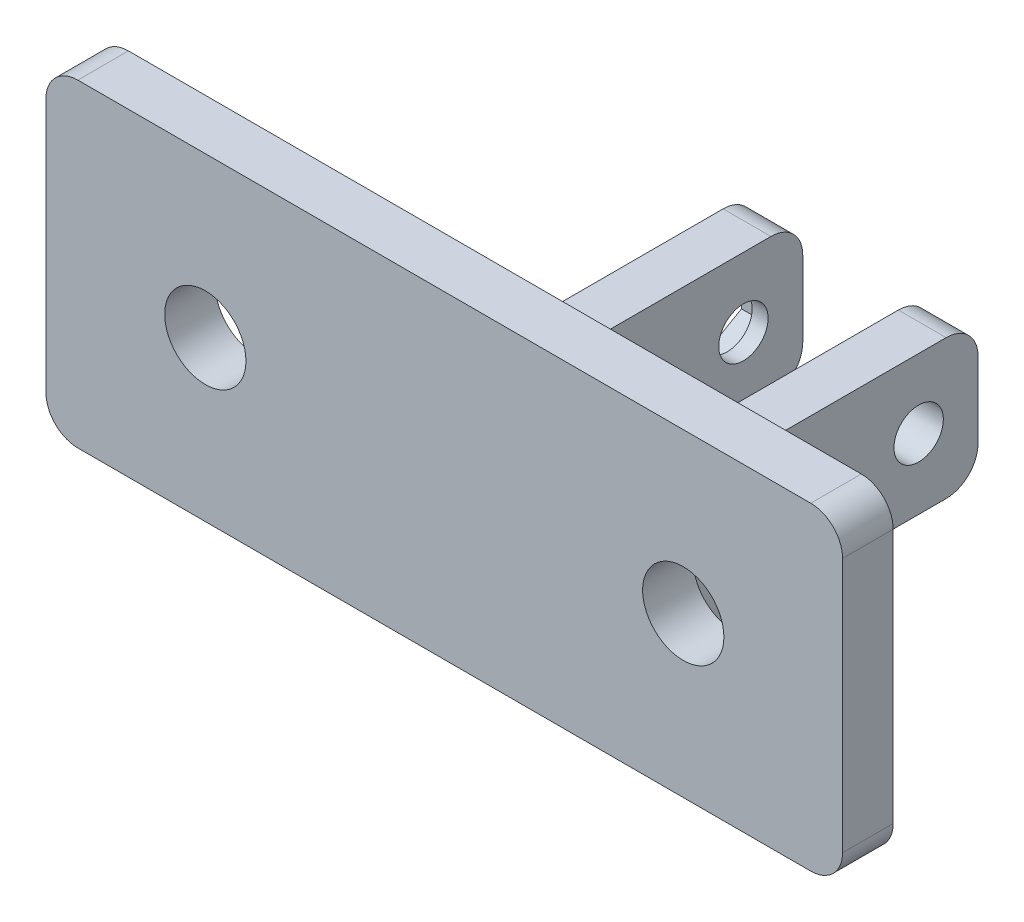
from build123d import *

# Parameters (mm, degrees)
SKETCH1_W           = 50
SKETCH1_H           = 20
SKETCH1_R           = 2.55
BOSS_EXTRUDE1_DEPTH = 3.175
BOSS_EXTRUDE2_START = 4
SKETCH3_W           = 26.5
SKETCH3_H           = 8.75
SKETCH3_R           = 1.55
BOSS_EXTRUDE2_DEPTH = 3
CUT_EXTRUDE1_START  = -7
SKETCH3_3_R         = 1.55
CUT_EXTRUDE1_DEPTH  = 2
FILLET1_R           = 2
FILLET2_R           = 2
SKETCH4_R           = 4.55
CUT_EXTRUDE2_DEPTH  = 1.5
FILLET3_R           = 1.5
FILLET4_R           = 1


with BuildPart() as part:
    # Sketch1 → Boss-Extrude1 (new body)
    with BuildSketch(Plane.XY):
        Rectangle(SKETCH1_W, SKETCH1_H)
        with Locations((-15, 0)):
            Circle(SKETCH1_R, mode=Mode.SUBTRACT)
        with Locations((15, 0)):
            Circle(SKETCH1_R, mode=Mode.SUBTRACT)
    extrude(amount=BOSS_EXTRUDE1_DEPTH)

    # Sketch3 → Boss-Extrude2 (add)
    # profile 1 of 3: a face of its own
    with BuildSketch(Plane(origin=(0, 0, 0), x_dir=(0, 0, -1), z_dir=(1, 0, 0)).offset(BOSS_EXTRUDE2_START)):
        with Locations((10.075, -5.625)):
            Rectangle(SKETCH3_W, SKETCH3_H)
        Polygon((22.475, -7.259882024), (22.475, -3.940117976), (19.6, -2.280235952), (16.725, -3.940117976), (16.725, -7.259882024), (19.6, -8.919764048), align=None, mode=Mode.SUBTRACT)
        Polygon((6.475, -7.259882024), (6.475, -3.940117976), (3.6, -2.280235952), (0.725, -3.940117976), (0.725, -7.259882024), (3.6, -8.919764048), align=None, mode=Mode.SUBTRACT)
    # profile 2 of 3: a face of its own
    with BuildSketch(Plane(origin=(0, 0, 0), x_dir=(0, 0, -1), z_dir=(1, 0, 0)).offset(BOSS_EXTRUDE2_START)):
        Polygon((3.6, -8.919764048), (6.475, -7.259882024), (6.475, -3.940117976), (3.6, -2.280235952), (0.725, -3.940117976), (0.725, -7.259882024), align=None)
        with Locations((3.6, -5.6)):
            Circle(SKETCH3_R, mode=Mode.SUBTRACT)
    # profile 3 of 3: a face of its own
    with BuildSketch(Plane(origin=(0, 0, 0), x_dir=(0, 0, -1), z_dir=(1, 0, 0)).offset(BOSS_EXTRUDE2_START)):
        Polygon((19.6, -8.919764048), (22.475, -7.259882024), (22.475, -3.940117976), (19.6, -2.280235952), (16.725, -3.940117976), (16.725, -7.259882024), align=None)
        with Locations((19.6, -5.6)):
            Circle(SKETCH3_R, mode=Mode.SUBTRACT)
    boss_extrude2 = extrude(amount=BOSS_EXTRUDE2_DEPTH)

    # Mirror1: Boss-Extrude2 across plane
    add(boss_extrude2.mirror(Plane(origin=(0, 0, 0), x_dir=(0, 0, 1), z_dir=(1, 0, 0))))

    # Sketch3<3> → Cut-Extrude1 (cut)
    # profile 1 of 2: a face of its own
    with BuildSketch(Plane(origin=(0, 0, 0), x_dir=(0, 0, -1), z_dir=(1, 0, 0)).offset(CUT_EXTRUDE1_START)):
        Polygon((3.6, -8.919764048), (6.475, -7.259882024), (6.475, -3.940117976), (3.6, -2.280235952), (0.725, -3.940117976), (0.725, -7.259882024), align=None)
        with Locations((3.6, -5.6)):
            Circle(SKETCH3_3_R, mode=Mode.SUBTRACT)
    # profile 2 of 2: a face of its own
    with BuildSketch(Plane(origin=(0, 0, 0), x_dir=(0, 0, -1), z_dir=(1, 0, 0)).offset(CUT_EXTRUDE1_START)):
        Polygon((19.6, -8.919764048), (22.475, -7.259882024), (22.475, -3.940117976), (19.6, -2.280235952), (16.725, -3.940117976), (16.725, -7.259882024), align=None)
        with Locations((19.6, -5.6)):
            Circle(SKETCH3_3_R, mode=Mode.SUBTRACT)
    extrude(amount=CUT_EXTRUDE1_DEPTH, mode=Mode.SUBTRACT)

    # Fillet1
    fillet1_edges = [part.edges().sort_by_distance(p)[0] for p in [
        (5.5, -1.25, 0),
        (-5.5, -1.25, 0),
    ]]
    fillet(fillet1_edges, radius=FILLET1_R)

    # Fillet2
    fillet2_edges = [part.edges().sort_by_distance(p)[0] for p in [
        (5.5, -10, -23.325),
        (5.5, -1.25, -23.325),
        (-5.5, -10, -23.325),
        (-5.5, -1.25, -23.325),
        (25, -10, 1.5875),
        (-25, -10, 1.5875),
        (-25, 10, 1.5875),
        (25, 10, 1.5875),
    ]]
    fillet(fillet2_edges, radius=FILLET2_R)

    # Sketch4 → Cut-Extrude2 (cut)
    with BuildSketch(Plane(origin=(0, 0, 0), x_dir=(-1, 0, 0), z_dir=(0, 0, -1))):
        Polygon((9, 2.75), (9, -8), (23, -8), (23, 8), (-23, 8), (-23, -8), (-9, -8), (-9, 2.75), (-2, 2.75), (-2, -8), (2, -8), (2, 2.75), align=None)
        with Locations((15, 0)):
            Circle(SKETCH4_R, mode=Mode.SUBTRACT)
        with Locations((-15, 0)):
            Circle(SKETCH4_R, mode=Mode.SUBTRACT)
    extrude(amount=-CUT_EXTRUDE2_DEPTH, mode=Mode.SUBTRACT)

    # Fillet3
    fillet3_edges = [part.edges().sort_by_distance(p)[0] for p in [
        (-9, -8, 0.75),
        (-9, 2.75, 0.75),
        (-2, 2.75, 0.75),
        (-2, -8, 0.75),
        (2, -8, 0.75),
        (2, 2.75, 0.75),
        (9, 2.75, 0.75),
        (9, -8, 0.75),
        (23, -8, 0.75),
        (23, 8, 0.75),
        (-23, 8, 0.75),
        (-23, -8, 0.75),
    ]]
    fillet(fillet3_edges, radius=FILLET3_R)

    # Fillet4
    # the kernel refuses this fillet: 1 mm, written as the material it adds along each edge
    with BuildSketch(Plane(origin=(-15, 0, 1.5), x_dir=(-1, 0, 0), z_dir=(0, -1, 0))) as fillet4_piece_1:
        with BuildLine():
            CenterArc((4.55 + FILLET4_R, FILLET4_R), FILLET4_R, 180, 90)
            Line((4.55, FILLET4_R), (4.55, 0))
            Line((4.55, 0), (4.55 + FILLET4_R, 0))
        make_face()
    revolve(axis=Axis((-15, 0, 1.5), (0, 0, -1)))
    with BuildSketch(Plane(origin=(15, 0, 1.5), x_dir=(-1, 0, 0), z_dir=(0, -1, 0))) as fillet4_piece_2:
        with BuildLine():
            CenterArc((4.55 + FILLET4_R, FILLET4_R), FILLET4_R, 180, 90)
            Line((4.55, FILLET4_R), (4.55, 0))
            Line((4.55, 0), (4.55 + FILLET4_R, 0))
        make_face()
    revolve(axis=Axis((15, 0, 1.5), (0, 0, -1)))
    with BuildSketch(Plane(origin=(-9, 1.25, 1.5), x_dir=(0, 0, -1), z_dir=(0, -1, 0)), Plane(origin=(-2, -6.5, 1.5), x_dir=(0, 0, -1), z_dir=(0, 1, 0)), Plane(origin=(9, -6.5, 1.5), x_dir=(0, 0, -1), z_dir=(0, 1, 0)), Plane(origin=(2, 1.25, 1.5), x_dir=(0, 0, -1), z_dir=(0, -1, 0))) as fillet4_piece_3:
        with BuildLine():
            CenterArc((FILLET4_R, -FILLET4_R), FILLET4_R, 90, 90)
            Line((0, -FILLET4_R), (0, 0))
            Line((0, 0), (FILLET4_R, 0))
        make_face()
    extrude(amount=7.75)
    with BuildSketch(Plane(origin=(-3.5, 2.75, 1.5), x_dir=(0, 0, -1), z_dir=(-1, 0, 0)), Plane(origin=(7.5, 2.75, 1.5), x_dir=(0, 0, -1), z_dir=(-1, 0, 0))) as fillet4_piece_4:
        with BuildLine():
            CenterArc((FILLET4_R, -FILLET4_R), FILLET4_R, 90, 90)
            Line((0, -FILLET4_R), (0, 0))
            Line((0, 0), (FILLET4_R, 0))
        make_face()
    extrude(amount=4)
    with BuildSketch(Plane(origin=(0.5, -8, 1.5), x_dir=(0, 0, -1), z_dir=(-1, 0, 0))) as fillet4_piece_5:
        with BuildLine():
            CenterArc((FILLET4_R, -FILLET4_R), FILLET4_R, 90, 90)
            Line((0, -FILLET4_R), (0, 0))
            Line((0, 0), (FILLET4_R, 0))
        make_face()
    extrude(amount=1)
    with BuildSketch(Plane(origin=(-10.5, -8, 1.5), x_dir=(0, 0, -1), z_dir=(-1, 0, 0)), Plane(origin=(21.5, -8, 1.5), x_dir=(0, 0, -1), z_dir=(-1, 0, 0))) as fillet4_piece_6:
        with BuildLine():
            CenterArc((FILLET4_R, -FILLET4_R), FILLET4_R, 90, 90)
            Line((0, -FILLET4_R), (0, 0))
            Line((0, 0), (FILLET4_R, 0))
        make_face()
    extrude(amount=11)
    with BuildSketch(Plane(origin=(-23, -6.5, 1.5), x_dir=(0, 0, -1), z_dir=(0, 1, 0)), Plane(origin=(23, 6.5, 1.5), x_dir=(0, 0, -1), z_dir=(0, -1, 0))) as fillet4_piece_7:
        with BuildLine():
            CenterArc((FILLET4_R, -FILLET4_R), FILLET4_R, 90, 90)
            Line((0, -FILLET4_R), (0, 0))
            Line((0, 0), (FILLET4_R, 0))
        make_face()
    extrude(amount=13)
    with BuildSketch(Plane(origin=(-21.5, 8, 1.5), x_dir=(0, 0, -1), z_dir=(1, 0, 0))) as fillet4_piece_8:
        with BuildLine():
            CenterArc((FILLET4_R, -FILLET4_R), FILLET4_R, 90, 90)
            Line((0, -FILLET4_R), (0, 0))
            Line((0, 0), (FILLET4_R, 0))
        make_face()
    extrude(amount=43)
    with BuildSketch(Plane(origin=(21.5, 6.5, 1.5), x_dir=(1, 0, 0), z_dir=(0, -1, 0))) as fillet4_piece_9:
        with BuildLine():
            CenterArc((1.5 - FILLET4_R, -FILLET4_R), FILLET4_R, 0, 90)
            Line((1.5 - FILLET4_R, 0), (1.5, 0))
            Line((1.5, 0), (1.5, -FILLET4_R))
        make_face()
    revolve(axis=Axis((21.5, 6.5, 1.5), (0, 0, 1)), revolution_arc=90)
    with BuildSketch(Plane(origin=(-10.5, -6.5, 1.5), x_dir=(0, -1, 0), z_dir=(-1, 0, 0))) as fillet4_piece_10:
        with BuildLine():
            CenterArc((1.5 - FILLET4_R, -FILLET4_R), FILLET4_R, 0, 90)
            Line((1.5 - FILLET4_R, 0), (1.5, 0))
            Line((1.5, 0), (1.5, -FILLET4_R))
        make_face()
    revolve(axis=Axis((-10.5, -6.5, 1.5), (0, 0, 1)), revolution_arc=90)
    with BuildSketch(Plane(origin=(-21.5, -6.5, 1.5), x_dir=(-1, 0, 0), z_dir=(0, 1, 0))) as fillet4_piece_11:
        with BuildLine():
            CenterArc((1.5 - FILLET4_R, -FILLET4_R), FILLET4_R, 0, 90)
            Line((1.5 - FILLET4_R, 0), (1.5, 0))
            Line((1.5, 0), (1.5, -FILLET4_R))
        make_face()
    revolve(axis=Axis((-21.5, -6.5, 1.5), (0, 0, 1)), revolution_arc=90)
    with BuildSketch(Plane(origin=(-21.5, 6.5, 1.5), x_dir=(0, 1, 0), z_dir=(1, 0, 0))) as fillet4_piece_12:
        with BuildLine():
            CenterArc((1.5 - FILLET4_R, -FILLET4_R), FILLET4_R, 0, 90)
            Line((1.5 - FILLET4_R, 0), (1.5, 0))
            Line((1.5, 0), (1.5, -FILLET4_R))
        make_face()
    revolve(axis=Axis((-21.5, 6.5, 1.5), (0, 0, 1)), revolution_arc=90)
    with BuildSketch(Plane(origin=(21.5, -6.5, 1.5), x_dir=(0, -1, 0), z_dir=(-1, 0, 0))) as fillet4_piece_13:
        with BuildLine():
            CenterArc((1.5 - FILLET4_R, -FILLET4_R), FILLET4_R, 0, 90)
            Line((1.5 - FILLET4_R, 0), (1.5, 0))
            Line((1.5, 0), (1.5, -FILLET4_R))
        make_face()
    revolve(axis=Axis((21.5, -6.5, 1.5), (0, 0, 1)), revolution_arc=90)
    with BuildSketch(Plane(origin=(10.5, -6.5, 1.5), x_dir=(-1, 0, 0), z_dir=(0, 1, 0))) as fillet4_piece_14:
        with BuildLine():
            CenterArc((1.5 - FILLET4_R, -FILLET4_R), FILLET4_R, 0, 90)
            Line((1.5 - FILLET4_R, 0), (1.5, 0))
            Line((1.5, 0), (1.5, -FILLET4_R))
        make_face()
    revolve(axis=Axis((10.5, -6.5, 1.5), (0, 0, 1)), revolution_arc=90)
    with BuildSketch(Plane(origin=(0.5, -6.5, 1.5), x_dir=(0, -1, 0), z_dir=(-1, 0, 0))) as fillet4_piece_15:
        with BuildLine():
            CenterArc((1.5 - FILLET4_R, -FILLET4_R), FILLET4_R, 0, 90)
            Line((1.5 - FILLET4_R, 0), (1.5, 0))
            Line((1.5, 0), (1.5, -FILLET4_R))
        make_face()
    revolve(axis=Axis((0.5, -6.5, 1.5), (0, 0, 1)), revolution_arc=90)
    with BuildSketch(Plane(origin=(-0.5, -6.5, 1.5), x_dir=(-1, 0, 0), z_dir=(0, 1, 0))) as fillet4_piece_16:
        with BuildLine():
            CenterArc((1.5 - FILLET4_R, -FILLET4_R), FILLET4_R, 0, 90)
            Line((1.5 - FILLET4_R, 0), (1.5, 0))
            Line((1.5, 0), (1.5, -FILLET4_R))
        make_face()
    revolve(axis=Axis((-0.5, -6.5, 1.5), (0, 0, 1)), revolution_arc=90)
    with BuildSketch(Plane(origin=(-7.5, 1.25, 1.5), x_dir=(0, 1, 0), z_dir=(1, 0, 0))) as fillet4_piece_17:
        with BuildLine():
            CenterArc((1.5 + FILLET4_R, -FILLET4_R), FILLET4_R, 90, 90)
            Line((1.5 + FILLET4_R, 0), (1.5, 0))
            Line((1.5, 0), (1.5, -FILLET4_R))
        make_face()
    revolve(axis=Axis((-7.5, 1.25, 1.5), (0, 0, 1)), revolution_arc=90)
    with BuildSketch(Plane(origin=(-3.5, 1.25, 1.5), x_dir=(0, 1, 0), z_dir=(-1, 0, 0))) as fillet4_piece_18:
        with BuildLine():
            CenterArc((1.5 + FILLET4_R, FILLET4_R), FILLET4_R, 180, 90)
            Line((1.5 + FILLET4_R, 0), (1.5, 0))
            Line((1.5, 0), (1.5, FILLET4_R))
        make_face()
    revolve(axis=Axis((-3.5, 1.25, 1.5), (0, 0, -1)), revolution_arc=90)
    with BuildSketch(Plane(origin=(3.5, 1.25, 1.5), x_dir=(-1, 0, 0), z_dir=(0, -1, 0))) as fillet4_piece_19:
        with BuildLine():
            CenterArc((1.5 + FILLET4_R, FILLET4_R), FILLET4_R, 180, 90)
            Line((1.5 + FILLET4_R, 0), (1.5, 0))
            Line((1.5, 0), (1.5, FILLET4_R))
        make_face()
    revolve(axis=Axis((3.5, 1.25, 1.5), (0, 0, -1)), revolution_arc=90)
    with BuildSketch(Plane(origin=(7.5, 1.25, 1.5), x_dir=(0, 1, 0), z_dir=(-1, 0, 0))) as fillet4_piece_20:
        with BuildLine():
            CenterArc((1.5 + FILLET4_R, FILLET4_R), FILLET4_R, 180, 90)
            Line((1.5 + FILLET4_R, 0), (1.5, 0))
            Line((1.5, 0), (1.5, FILLET4_R))
        make_face()
    revolve(axis=Axis((7.5, 1.25, 1.5), (0, 0, -1)), revolution_arc=90)


solid = part.part
